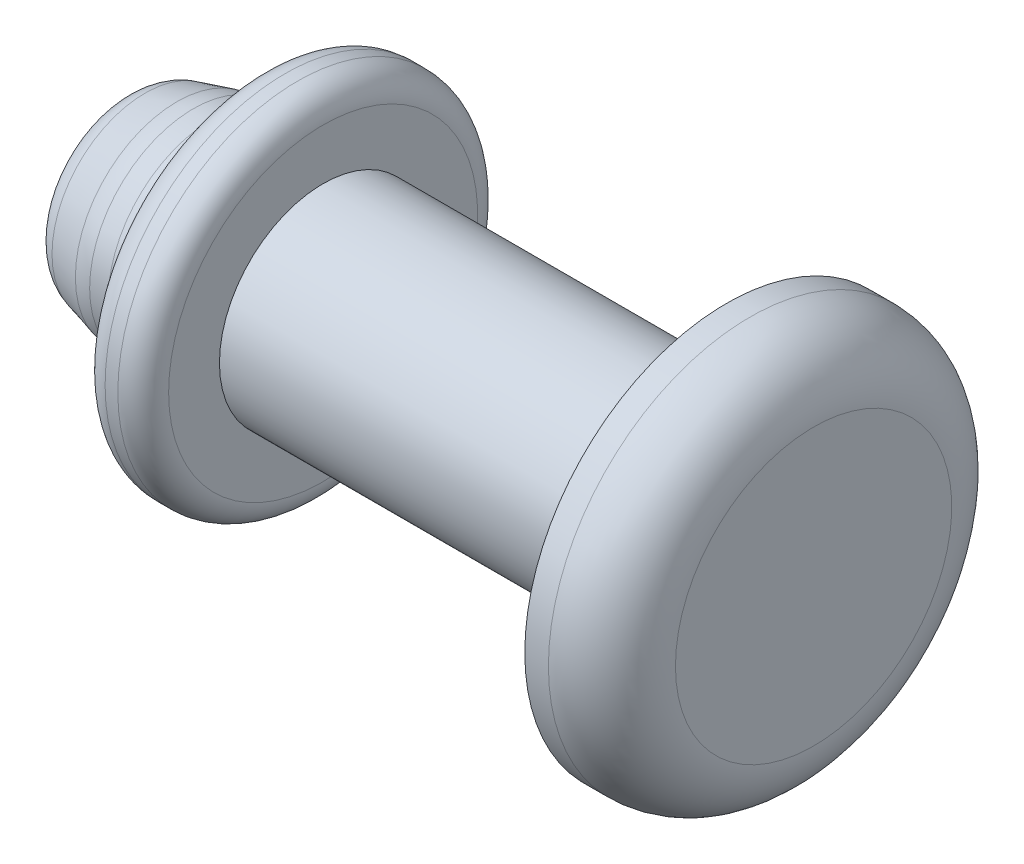
from build123d import *


with BuildPart() as part:
    # Sketch2 → Revolve1 (revolve)
    with BuildSketch(Plane.XY):
        with BuildLine():
            Line((0, 0), (0, 2.175))
            ThreePointArc((0, 2.175), (-0.292893219, 2.882106781), (-1, 3.175))
            Line((-1, 3.175), (-1.3716, 3.175))
            Line((-1.3716, 3.175), (-1.3716, 1.63195))
            Line((-1.3716, 1.63195), (-7.7216, 1.63195))
            Line((-7.7216, 1.63195), (-7.7216, 2.43195))
            ThreePointArc((-7.7216, 2.43195), (-7.838757288, 2.714792712), (-8.1216, 2.83195))
            Line((-8.1216, 2.83195), (-8.3216, 2.83195))
            ThreePointArc((-8.3216, 2.83195), (-8.604442712, 2.714792712), (-8.7216, 2.43195))
            Line((-8.7216, 2.43195), (-8.7216, 2.38195))
            ThreePointArc((-8.7216, 2.38195), (-8.941269914, 1.851619914), (-9.4716, 1.63195))
            Line((-9.4716, 1.63195), (-9.764947502, 1.63195))
            ThreePointArc((-9.764947502, 1.63195), (-9.895473695, 1.623394861), (-10.023766548, 1.597875826))
            Line((-10.023766548, 1.597875826), (-10.526009523, 1.463300227))
            ThreePointArc((-10.526009523, 1.463300227), (-10.79327667, 1.284718028), (-10.8966, 0.980337314))
            Line((-10.8966, 0.980337314), (-10.8966, 0))
            Line((-10.8966, 0), (0, 0))
        make_face()
    revolve(axis=Axis((-42.300017882, 0, 0), (1, 0, 0)))


solid = part.part
